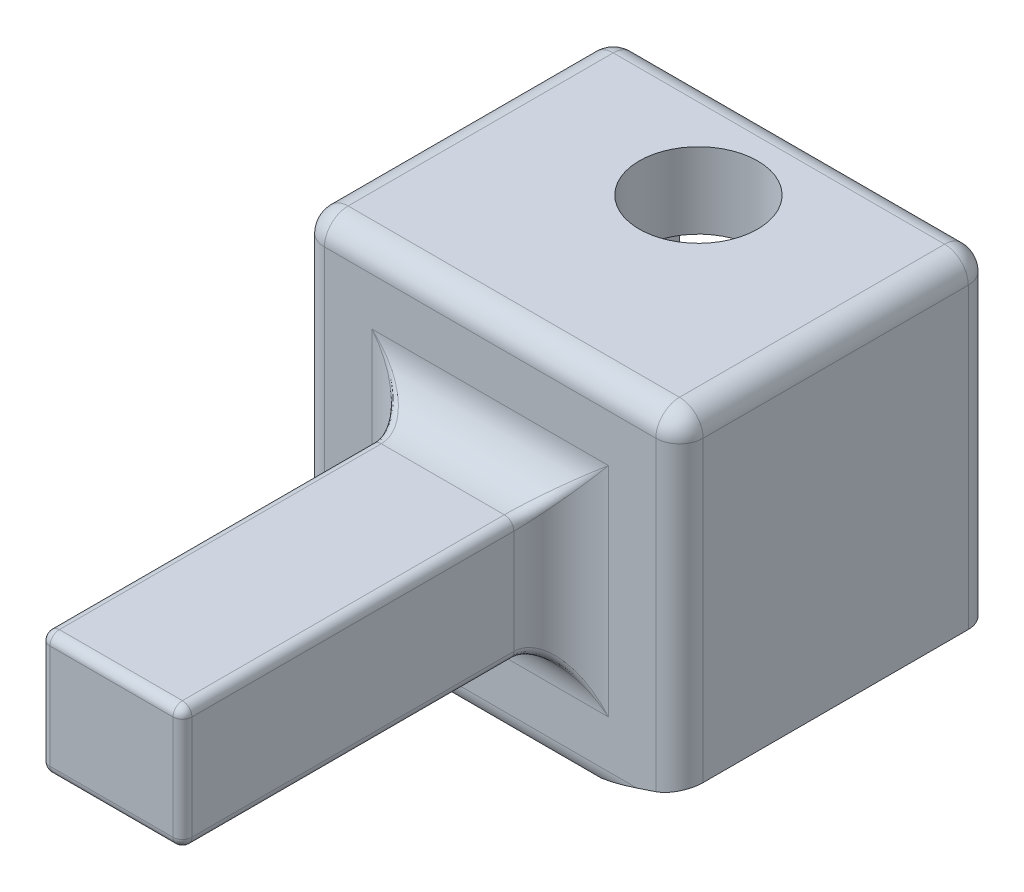
from build123d import *

# Parameters (mm, degrees)
SKETCH1_W               = 10.16
SKETCH1_H               = 9.652
BOSS_EXTRUDE1_DEPTH     = 7.112
CUT_EXTRUDE1_DEPTH      = 14.021061708
CUT_EXTRUDE1_DEPTH_BACK = 14.021061708
SKETCH2_R               = 1.5875
SKETCH7_W               = 10.16
SKETCH7_H               = 9.652
BOSS_EXTRUDE3_DEPTH     = 1.27
FILLET1_R               = 0.635
FILLET3_R               = 0.635
FILLET4_R               = 0.381
CUT_EXTRUDE3_DEPTH      = 14.485940976
CUT_EXTRUDE3_DEPTH_BACK = 14.485940976
FILLET9_R               = 0.254
CUT_EXTRUDE7_DEPTH      = 9.654656319
SKETCH14_W              = 3.81
SKETCH14_H              = 3.302
BOSS_EXTRUDE4_DEPTH     = 10.16
FILLET14_R              = 1.27
FILLET15_R              = 0.254


with BuildPart() as part:
    # Sketch1 → Boss-Extrude1 (new body)
    with BuildSketch(Plane.XY):
        Rectangle(SKETCH1_W, SKETCH1_H)
        Polygon((-4.318, -3.81), (4.318, -3.81), (4.318, -1.016), (3.302, -1.016), (3.302, 2.794), (-3.302, 2.794), (-3.302, -1.016), (-4.318, -1.016), align=None, mode=Mode.SUBTRACT)
    extrude(amount=BOSS_EXTRUDE1_DEPTH)

    # Sketch2 → Cut-Extrude1 (cut, two sides: drawn at the far end of the back side and taken through both)
    with BuildSketch(Plane(origin=(0, 4.826, 0), x_dir=(1, 0, 0), z_dir=(0, 1, 0)).offset(-CUT_EXTRUDE1_DEPTH_BACK)):
        with Locations(Location((0, -2.794, 0), (0, 0, 90))):
            Circle(SKETCH2_R)
    extrude(amount=CUT_EXTRUDE1_DEPTH + CUT_EXTRUDE1_DEPTH_BACK, mode=Mode.SUBTRACT)

    # Sketch7 → Boss-Extrude3 (add)
    with BuildSketch(Plane.XY.offset(7.112)):
        Rectangle(SKETCH7_W, SKETCH7_H)
    extrude(amount=BOSS_EXTRUDE3_DEPTH)

    # Fillet1
    fillet1_edges = [part.edges().sort_by_distance(p)[0] for p in [
        (-5.08, 0, 0),
        (0, 4.826, 0),
        (5.08, 0, 0),
    ]]
    fillet(fillet1_edges, radius=FILLET1_R)

    # Fillet3
    # the kernel refuses this fillet: 0.635 mm, written as the material it takes off along each edge
    with BuildSketch(Plane(origin=(4.445, 4.191, 0.635), x_dir=(1, 0, 0), z_dir=(0, 1, 0))) as fillet3_piece_1_section:
        Polygon((0, 0), (FILLET3_R, 0), (FILLET3_R, FILLET3_R), (0, FILLET3_R), align=None)
    fillet3_piece_1 = extrude(amount=FILLET3_R, mode=Mode.PRIVATE)
    fillet3_piece_1 = fillet3_piece_1 - Plane(origin=(4.445, 4.191, 0.635), x_dir=(-0.7071067811865475, 0, 0.7071067811865475), z_dir=(0, 1, 0)) * Sphere(FILLET3_R, mode=Mode.PRIVATE)
    add(fillet3_piece_1, mode=Mode.SUBTRACT)
    with BuildSketch(Plane(origin=(-4.445, 4.191, 0.635), x_dir=(-1, 0, 0), z_dir=(0, 1, 0))) as fillet3_piece_2_section:
        Polygon((0, 0), (FILLET3_R, 0), (FILLET3_R, -FILLET3_R), (0, -FILLET3_R), align=None)
    fillet3_piece_2 = extrude(amount=FILLET3_R, mode=Mode.PRIVATE)
    fillet3_piece_2 = fillet3_piece_2 - Plane(origin=(-4.445, 4.191, 0.635), x_dir=(0.7071067811865475, 0, 0.7071067811865475), z_dir=(0, 1, 0)) * Sphere(FILLET3_R, mode=Mode.PRIVATE)
    add(fillet3_piece_2, mode=Mode.SUBTRACT)
    with BuildSketch(Plane(origin=(-4.445, -4.191, 7.747), x_dir=(0, 0, 1), z_dir=(-1, 0, 0))) as fillet3_piece_3_section:
        Polygon((0, 0), (FILLET3_R, 0), (FILLET3_R, -FILLET3_R), (0, -FILLET3_R), align=None)
    fillet3_piece_3 = extrude(amount=FILLET3_R, mode=Mode.PRIVATE)
    fillet3_piece_3 = fillet3_piece_3 - Plane(origin=(-4.445, -4.191, 7.747), x_dir=(0, 0.7071067811865475, -0.7071067811865475), z_dir=(-1, 0, 0)) * Sphere(FILLET3_R, mode=Mode.PRIVATE)
    add(fillet3_piece_3, mode=Mode.SUBTRACT)
    with BuildSketch(Plane(origin=(-4.445, 4.191, 7.747), x_dir=(-1, 0, 0), z_dir=(0, 1, 0))) as fillet3_piece_4_section:
        Polygon((0, 0), (FILLET3_R, 0), (FILLET3_R, FILLET3_R), (0, FILLET3_R), align=None)
    fillet3_piece_4 = extrude(amount=FILLET3_R, mode=Mode.PRIVATE)
    fillet3_piece_4 = fillet3_piece_4 - Plane(origin=(-4.445, 4.191, 7.747), x_dir=(0.7071067811865475, 0, -0.7071067811865475), z_dir=(0, 1, 0)) * Sphere(FILLET3_R, mode=Mode.PRIVATE)
    add(fillet3_piece_4, mode=Mode.SUBTRACT)
    with BuildSketch(Plane(origin=(4.445, -4.191, 7.747), x_dir=(1, 0, 0), z_dir=(0, 0, 1))) as fillet3_piece_5_section:
        Polygon((0, 0), (FILLET3_R, 0), (FILLET3_R, -FILLET3_R), (0, -FILLET3_R), align=None)
    fillet3_piece_5 = extrude(amount=FILLET3_R, mode=Mode.PRIVATE)
    fillet3_piece_5 = fillet3_piece_5 - Plane(origin=(4.445, -4.191, 7.747), x_dir=(-0.7071067811865476, 0.7071067811865475, 0), z_dir=(0, 0, 1)) * Sphere(FILLET3_R, mode=Mode.PRIVATE)
    add(fillet3_piece_5, mode=Mode.SUBTRACT)
    with BuildSketch(Plane(origin=(4.445, 4.191, 7.747), x_dir=(0, 0, 1), z_dir=(0, 1, 0))) as fillet3_piece_6_section:
        Polygon((0, 0), (FILLET3_R, 0), (FILLET3_R, FILLET3_R), (0, FILLET3_R), align=None)
    fillet3_piece_6 = extrude(amount=FILLET3_R, mode=Mode.PRIVATE)
    fillet3_piece_6 = fillet3_piece_6 - Plane(origin=(4.445, 4.191, 7.747), x_dir=(-0.7071067811865475, 0, -0.7071067811865475), z_dir=(0, 1, 0)) * Sphere(FILLET3_R, mode=Mode.PRIVATE)
    add(fillet3_piece_6, mode=Mode.SUBTRACT)
    with BuildSketch(Plane(origin=(-5.08, -4.191, 8.382), x_dir=(0, 0, -1), z_dir=(0, 1, 0))) as fillet3_piece_7:
        with BuildLine():
            CenterArc((FILLET3_R, -FILLET3_R), FILLET3_R, 90, 90)
            Line((0, -FILLET3_R), (0, 0))
            Line((0, 0), (FILLET3_R, 0))
        make_face()
    extrude(amount=8.382, mode=Mode.SUBTRACT)
    with BuildSketch(Plane(origin=(4.445, -4.826, 8.382), x_dir=(0, 1, 0), z_dir=(-1, 0, 0)), Plane(origin=(4.445, -4.826, 0), x_dir=(0, 0, 1), z_dir=(-1, 0, 0))) as fillet3_piece_8:
        with BuildLine():
            CenterArc((FILLET3_R, FILLET3_R), FILLET3_R, 180, 90)
            Line((0, FILLET3_R), (0, 0))
            Line((0, 0), (FILLET3_R, 0))
        make_face()
    extrude(amount=8.89, mode=Mode.SUBTRACT)
    with BuildSketch(Plane(origin=(5.08, 4.191, 8.382), x_dir=(-1, 0, 0), z_dir=(0, -1, 0))) as fillet3_piece_9:
        with BuildLine():
            CenterArc((FILLET3_R, FILLET3_R), FILLET3_R, 180, 90)
            Line((0, FILLET3_R), (0, 0))
            Line((0, 0), (FILLET3_R, 0))
        make_face()
    extrude(amount=8.382, mode=Mode.SUBTRACT)
    with BuildSketch(Plane(origin=(-4.445, 4.826, 8.382), x_dir=(0, 0, -1), z_dir=(1, 0, 0))) as fillet3_piece_10:
        with BuildLine():
            CenterArc((FILLET3_R, -FILLET3_R), FILLET3_R, 90, 90)
            Line((0, -FILLET3_R), (0, 0))
            Line((0, 0), (FILLET3_R, 0))
        make_face()
    extrude(amount=8.89, mode=Mode.SUBTRACT)
    with BuildSketch(Plane(origin=(4.445, -4.826, 0.635), x_dir=(0, 0, -1), z_dir=(-1, 0, 0))) as fillet3_piece_11:
        with BuildLine():
            CenterArc((0.635 - FILLET3_R, -FILLET3_R), FILLET3_R, 0, 90)
            Line((0.635, -FILLET3_R), (0.635, 0))
            Line((0.635, 0), (0.635 - FILLET3_R, 0))
        make_face()
    revolve(axis=Axis((4.445, -4.826, 0.635), (0, -1, 0)), revolution_arc=90, mode=Mode.SUBTRACT)
    with BuildSketch(Plane(origin=(-4.445, -4.826, 0.635), x_dir=(0, 0, -1), z_dir=(1, 0, 0))) as fillet3_piece_12:
        with BuildLine():
            CenterArc((0.635 - FILLET3_R, FILLET3_R), FILLET3_R, 270, 90)
            Line((0.635, FILLET3_R), (0.635, 0))
            Line((0.635, 0), (0.635 - FILLET3_R, 0))
        make_face()
    revolve(axis=Axis((-4.445, -4.826, 0.635), (0, 1, 0)), revolution_arc=90, mode=Mode.SUBTRACT)
    with BuildSketch(Plane(origin=(5.08, -4.826, 7.747), x_dir=(0, 1, 0), z_dir=(0, 0, -1)), Plane(origin=(-5.08, -4.826, 0.635), x_dir=(0, 1, 0), z_dir=(0, 0, 1)), Plane(origin=(-5.08, 4.826, 0.635), x_dir=(1, 0, 0), z_dir=(0, 0, 1)), Plane(origin=(5.08, 4.826, 7.747), x_dir=(-1, 0, 0), z_dir=(0, 0, -1))) as fillet3_piece_13:
        with BuildLine():
            CenterArc((FILLET3_R, -FILLET3_R), FILLET3_R, 90, 90)
            Line((0, -FILLET3_R), (0, 0))
            Line((0, 0), (FILLET3_R, 0))
        make_face()
    extrude(amount=7.112, mode=Mode.SUBTRACT)

    # Fillet4
    fillet4_edges = [part.edges().sort_by_distance(p)[0] for p in [
        (3.302, -1.016, 3.556),
        (-3.302, -1.016, 3.556),
    ]]
    fillet(fillet4_edges, radius=FILLET4_R)

    # Sketch11 → Cut-Extrude3 (cut, two sides: drawn at the far end of the back side and taken through both)
    with BuildSketch(Plane.ZY.offset(-4.318).offset(-CUT_EXTRUDE3_DEPTH_BACK)):
        Polygon((0, -3.81), (5.08, -3.81), (5.08, -4.064), (10.16, -4.826), (0, -4.826), align=None)
    extrude(amount=CUT_EXTRUDE3_DEPTH + CUT_EXTRUDE3_DEPTH_BACK, mode=Mode.SUBTRACT)

    # Fillet9
    fillet9_edges = [part.edges().sort_by_distance(p)[0] for p in [
        (-4.318, -3.81, 6.096),
        (4.318, -3.81, 6.096),
        (0, -3.81, 7.112),
    ]]
    fillet(fillet9_edges, radius=FILLET9_R)

    # Sketch13 → Cut-Extrude7 (cut, through all)
    with BuildSketch(Plane(origin=(0, 0, 5.08), x_dir=(-1, 0, 0), z_dir=(0, 0, -1))):
        Polygon((-5.08, -3.81), (-5.08, -4.826), (-2.032, -4.826), align=None)
        Polygon((5.08, -3.81), (5.08, -4.826), (2.032, -4.826), align=None)
    extrude(amount=-CUT_EXTRUDE7_DEPTH, mode=Mode.SUBTRACT)

    # Sketch14 → Boss-Extrude4 (add)
    with BuildSketch(Plane.XY.offset(8.382)):
        Rectangle(SKETCH14_W, SKETCH14_H)
    extrude(amount=BOSS_EXTRUDE4_DEPTH)

    # Fillet14
    fillet14_edges = [part.edges().sort_by_distance(p)[0] for p in [
        (0, 1.651, 8.382),
        (-1.905, 0, 8.382),
        (0, -1.651, 8.382),
        (1.905, 0, 8.382),
    ]]
    fillet(fillet14_edges, radius=FILLET14_R)

    # Fillet15
    fillet15_edges = [part.edges().sort_by_distance(p)[0] for p in [
        (1.905, 1.651, 14.097),
        (-1.905, 1.651, 14.097),
        (-1.905, -1.651, 14.097),
        (1.905, -1.651, 14.097),
        (0, 1.651, 18.542),
        (-1.905, 0, 18.542),
        (0, -1.651, 18.542),
        (1.905, 0, 18.542),
        (2.354517888, 2.100517888, 8.682614059),
        (2.354517888, -2.100517888, 8.682614059),
        (-2.354517888, 2.100517888, 8.682614059),
        (-2.354517888, -2.100517888, 8.682614059),
    ]]
    fillet(fillet15_edges, radius=FILLET15_R)


solid = part.part
